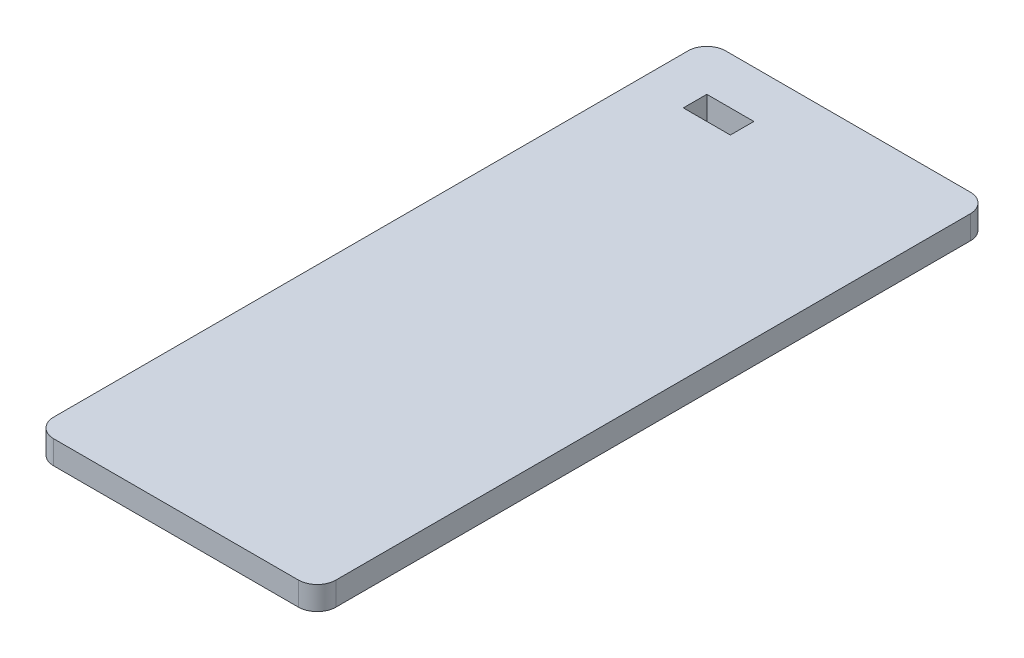
from build123d import *

# Parameters (mm, degrees)
SKETCH1_W           = 38.1
SKETCH1_H           = 90.7
BOSS_EXTRUDE1_DEPTH = 3.175
SKETCH2_W           = 6.35
SKETCH2_H           = 3.175
CUT_EXTRUDE1_DEPTH  = 99.428555943
FILLET1_R           = 2.54


with BuildPart() as part:
    # Sketch1 → Boss-Extrude1 (new body)
    with BuildSketch(Plane(origin=(0, 0, 0), x_dir=(1, 0, 0), z_dir=(0, 1, 0))):
        with Locations((19.05, 45.35)):
            Rectangle(SKETCH1_W, SKETCH1_H)
    extrude(amount=BOSS_EXTRUDE1_DEPTH)

    # Sketch2 → Cut-Extrude1 (cut, through all)
    with BuildSketch(Plane(origin=(0, 3.175, 0), x_dir=(1, 0, 0), z_dir=(0, 1, 0))):
        with Locations((9.525, 82.7625)):
            Rectangle(SKETCH2_W, SKETCH2_H)
    extrude(amount=-CUT_EXTRUDE1_DEPTH, mode=Mode.SUBTRACT)

    # Fillet1
    fillet1_edges = [part.edges().sort_by_distance(p)[0] for p in [
        (38.1, 1.5875, 0),
        (0, 1.5875, 0),
        (38.1, 1.5875, -90.7),
        (0, 1.5875, -90.7),
    ]]
    fillet(fillet1_edges, radius=FILLET1_R)


solid = part.part
